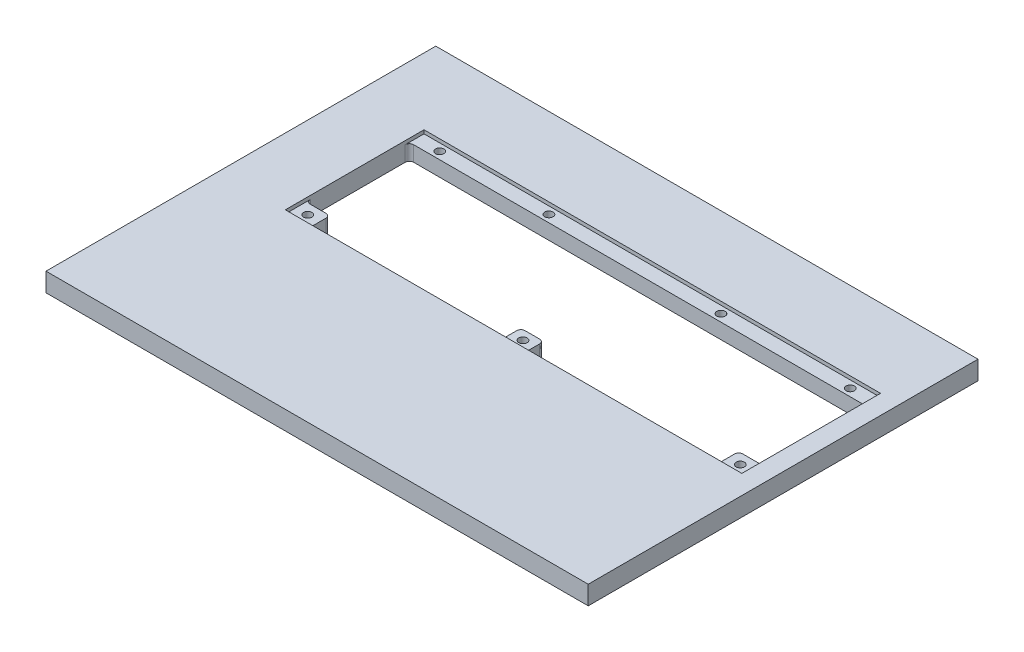
from build123d import *

# Parameters (mm, degrees)
SKETCH1_W           = 260
SKETCH1_H           = 186.9
BOSS_EXTRUDE1_DEPTH = 9
SKETCH2_W           = 218.9
SKETCH2_H           = 66.5
CUT_EXTRUDE1_DEPTH  = 9
SKETCH4_W           = 218.9
SKETCH4_H           = 7
SKETCH4_W_2         = 11.5
SKETCH4_H_2         = 10
SKETCH4_W_3         = 11
SKETCH4_H_3         = 9
BOSS_EXTRUDE2_DEPTH = 7.3
SKETCH3_R           = 2
CUT_EXTRUDE2_DEPTH  = 6.6
FILLET1_R           = 2


with BuildPart() as part:
    # Sketch1 → Boss-Extrude1 (new body)
    with BuildSketch(Plane(origin=(0, 0, 0), x_dir=(1, 0, 0), z_dir=(0, 1, 0))):
        with Locations((115, 93.45)):
            Rectangle(SKETCH1_W, SKETCH1_H)
    extrude(amount=BOSS_EXTRUDE1_DEPTH)

    # Sketch2 → Cut-Extrude1 (cut)
    with BuildSketch(Plane(origin=(0, 0, 0), x_dir=(1, 0, 0), z_dir=(0, 1, 0))):
        with Locations((126.36, 116.1)):
            Rectangle(SKETCH2_W, SKETCH2_H)
    extrude(amount=CUT_EXTRUDE1_DEPTH, mode=Mode.SUBTRACT)

    # Sketch4 → Boss-Extrude2 (add)
    with BuildSketch(Plane(origin=(0, 0, 0), x_dir=(1, 0, 0), z_dir=(0, 1, 0))):
        with Locations((126.36, 145.85)):
            Rectangle(SKETCH4_W, SKETCH4_H)
        with Locations((230.06, 87.85)):
            Rectangle(SKETCH4_W_2, SKETCH4_H_2)
        with Locations((126.36, 87.35)):
            Rectangle(SKETCH4_W_3, SKETCH4_H_3)
        with Locations((22.66, 87.85)):
            Rectangle(SKETCH4_W_2, SKETCH4_H_2)
    extrude(amount=BOSS_EXTRUDE2_DEPTH)

    # Sketch3 → Cut-Extrude2 (cut)
    with BuildSketch(Plane(origin=(0, 9, 0), x_dir=(1, 0, 0), z_dir=(0, 1, 0))):
        with Locations((27.91, 145.85)):
            Circle(SKETCH3_R)
        with Locations((80.31, 145.85)):
            Circle(SKETCH3_R)
        with Locations((162.81, 145.85)):
            Circle(SKETCH3_R)
        with Locations((224.81, 145.85)):
            Circle(SKETCH3_R)
        with Locations((22.66, 87.85)):
            Circle(SKETCH3_R)
        with Locations((126.36, 87.35)):
            Circle(SKETCH3_R)
        with Locations((230.06, 87.85)):
            Circle(SKETCH3_R)
    extrude(amount=-CUT_EXTRUDE2_DEPTH, mode=Mode.SUBTRACT)

    # Fillet1
    fillet1_edges = [part.edges().sort_by_distance(p)[0] for p in [
        (16.91, 3.65, -92.85),
        (28.41, 3.65, -82.85),
        (28.41, 3.65, -92.85),
        (16.91, 3.65, -142.35),
        (235.81, 3.65, -142.35),
        (235.81, 3.65, -92.85),
        (224.31, 3.65, -82.85),
        (224.31, 3.65, -92.85),
        (120.86, 3.65, -82.85),
        (131.86, 3.65, -82.85),
        (131.86, 3.65, -91.85),
        (120.86, 3.65, -91.85),
    ]]
    fillet(fillet1_edges, radius=FILLET1_R)


solid = part.part
